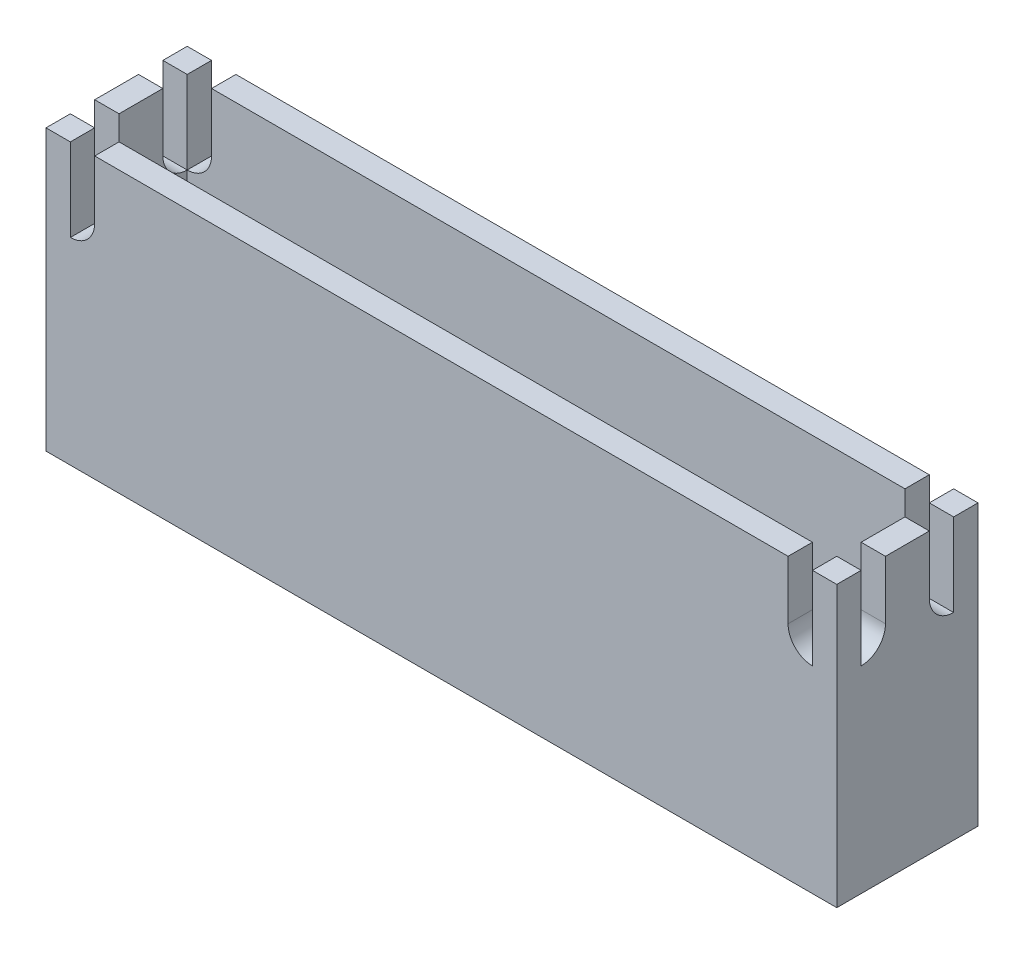
from build123d import *

# Parameters (mm, degrees)
SZKIC1_W                    = 32.48
SZKIC1_H                    = 5.8
DODANIE_WYCI_GNI_CIE1_DEPTH = 3.4
SZKIC2_W                    = 0.64
SZKIC2_H                    = 0.64
WYTNIJ_WYCI_GNI_CIE1_DEPTH  = 3.4
SZKIC3_W                    = 32.48
SZKIC3_H                    = 5.8
SZKIC3_W_2                  = 30.48
SZKIC3_H_2                  = 3.8
DODANIE_WYCI_GNI_CIE2_DEPTH = 8.1
SZKIC4_W                    = 1
SZKIC4_H                    = 1
WYTNIJ_WYCI_GNI_CIE2_DEPTH  = 3.4
ZAOKR_GLENIE1_R             = 1


with BuildPart() as part:
    # Szkic1 → Dodanie-wyciągnięcie1 (new body)
    with BuildSketch(Plane(origin=(0, 0, 0), x_dir=(1, 0, 0), z_dir=(0, 1, 0))):
        with Locations((-4.592060125, -1.597771029)):
            Rectangle(SZKIC1_W, SZKIC1_H)
    extrude(amount=DODANIE_WYCI_GNI_CIE1_DEPTH)

    # Szkic2 → Wytnij-wyciągnięcie1 (cut)
    with BuildSketch(Plane(origin=(0, 3.4, 0), x_dir=(1, 0, 0), z_dir=(0, 1, 0))):
        with Locations((-18.562060125, -1.597771029)):
            Rectangle(SZKIC2_W, SZKIC2_H)
        with Locations((-16.022060125, -1.597771029)):
            Rectangle(SZKIC2_W, SZKIC2_H)
        with Locations((-13.482060125, -1.597771029)):
            Rectangle(SZKIC2_W, SZKIC2_H)
        with Locations((-10.942060125, -1.597771029)):
            Rectangle(SZKIC2_W, SZKIC2_H)
        with Locations((-8.402060125, -1.597771029)):
            Rectangle(SZKIC2_W, SZKIC2_H)
        with Locations((-5.862060125, -1.597771029)):
            Rectangle(SZKIC2_W, SZKIC2_H)
        with Locations((-3.322060125, -1.597771029)):
            Rectangle(SZKIC2_W, SZKIC2_H)
        with Locations((-0.782060125, -1.597771029)):
            Rectangle(SZKIC2_W, SZKIC2_H)
        with Locations((1.757939875, -1.597771029)):
            Rectangle(SZKIC2_W, SZKIC2_H)
        with Locations((4.297939875, -1.597771029)):
            Rectangle(SZKIC2_W, SZKIC2_H)
        with Locations((6.837939875, -1.597771029)):
            Rectangle(SZKIC2_W, SZKIC2_H)
        with Locations((9.377939875, -1.597771029)):
            Rectangle(SZKIC2_W, SZKIC2_H)
    extrude(amount=-WYTNIJ_WYCI_GNI_CIE1_DEPTH, mode=Mode.SUBTRACT)

    # Szkic3 → Dodanie-wyciągnięcie2 (add)
    with BuildSketch(Plane(origin=(0, 3.4, 0), x_dir=(1, 0, 0), z_dir=(0, 1, 0))):
        with Locations((-4.592060125, -1.597771029)):
            Rectangle(SZKIC3_W, SZKIC3_H)
        with Locations((-4.592060125, -1.597771029)):
            Rectangle(SZKIC3_W_2, SZKIC3_H_2, mode=Mode.SUBTRACT)
    extrude(amount=DODANIE_WYCI_GNI_CIE2_DEPTH)

    # Szkic4 → Wytnij-wyciągnięcie2 (cut)
    with BuildSketch(Plane(origin=(0, 11.5, 0), x_dir=(1, 0, 0), z_dir=(0, 1, 0))):
        with Locations((-20.332060125, -2.997771029)):
            Rectangle(SZKIC4_W, SZKIC4_H)
        with Locations((-19.332060125, -3.997771029)):
            Rectangle(SZKIC4_W, SZKIC4_H)
        with Locations((-20.332060125, -0.197771029)):
            Rectangle(SZKIC4_W, SZKIC4_H)
        with Locations((-19.332060125, 0.802228971)):
            Rectangle(SZKIC4_W, SZKIC4_H)
        with Locations((10.147939875, 0.802228971)):
            Rectangle(SZKIC4_W, SZKIC4_H)
        with Locations((11.147939875, -0.197771029)):
            Rectangle(SZKIC4_W, SZKIC4_H)
        with Locations((11.147939875, -2.997771029)):
            Rectangle(SZKIC4_W, SZKIC4_H)
        with Locations((10.147939875, -3.997771029)):
            Rectangle(SZKIC4_W, SZKIC4_H)
    extrude(amount=-WYTNIJ_WYCI_GNI_CIE2_DEPTH, mode=Mode.SUBTRACT)

    # Zaokrąglenie1
    zaokr_glenie1_edges = [part.edges().sort_by_distance(p)[0] for p in [
        (11.147939875, 8.1, 2.497771029),
        (11.147939875, 8.1, 0.697771029),
        (9.647939875, 8.1, -0.802228971),
        (9.647939875, 8.1, 3.997771029),
        (-18.832060125, 8.1, -0.802228971),
        (-20.332060125, 8.1, 0.697771029),
        (-20.332060125, 8.1, 2.497771029),
        (-18.832060125, 8.1, 3.997771029),
    ]]
    fillet(zaokr_glenie1_edges, radius=ZAOKR_GLENIE1_R - 0.0001)  # a hair under: the kernel refuses the full size


solid = part.part
